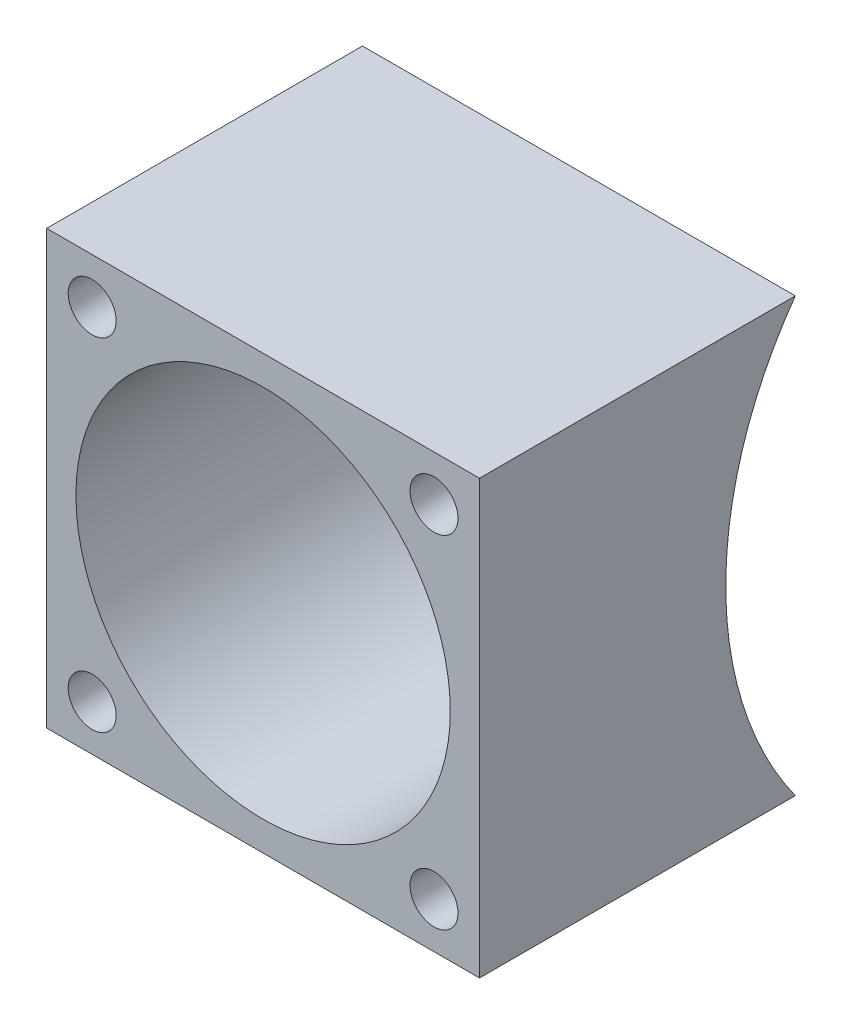
from build123d import *

# Parameters (mm, degrees)
SKETCH1_W               = 37
SKETCH1_H               = 37
BOSS_EXTRUDE1_DEPTH     = 52.8
CUT_EXTRUDE1_DEPTH      = 20
CUT_EXTRUDE1_DEPTH_BACK = 20
SKETCH2_R               = 31.75
SKETCH5_R               = 16
CUT_EXTRUDE2_DEPTH      = 59.926564468
SKETCH6_R               = 2.05
CUT_EXTRUDE3_DEPTH      = 38.594141996


with BuildPart() as part:
    # Sketch1 → Boss-Extrude1 (new body)
    with BuildSketch(Plane.XY):
        Rectangle(SKETCH1_W, SKETCH1_H)
    extrude(amount=BOSS_EXTRUDE1_DEPTH)

    # Sketch2 → Cut-Extrude1 (cut, two sides: drawn at the far end of the back side and taken through both)
    with BuildSketch(Plane(origin=(0, 0, 0), x_dir=(0, 0, -1), z_dir=(1, 0, 0)).offset(-CUT_EXTRUDE1_DEPTH_BACK)):
        Circle(SKETCH2_R)
    extrude(amount=CUT_EXTRUDE1_DEPTH + CUT_EXTRUDE1_DEPTH_BACK, mode=Mode.SUBTRACT)

    # Sketch5 → Cut-Extrude2 (cut, through all)
    with BuildSketch(Plane.XY):
        Circle(SKETCH5_R)
    extrude(amount=CUT_EXTRUDE2_DEPTH, mode=Mode.SUBTRACT)

    # Sketch6 → Cut-Extrude3 (cut, through all)
    with BuildSketch(Plane.XY.offset(52.8)):
        with Locations((-14.610912703, -14.610912703)):
            Circle(SKETCH6_R)
        with Locations((14.610912703, -14.610912703)):
            Circle(SKETCH6_R)
        with Locations((14.610912703, 14.610912703)):
            Circle(SKETCH6_R)
        with Locations((-14.610912703, 14.610912703)):
            Circle(SKETCH6_R)
    extrude(amount=-CUT_EXTRUDE3_DEPTH, mode=Mode.SUBTRACT)


solid = part.part
